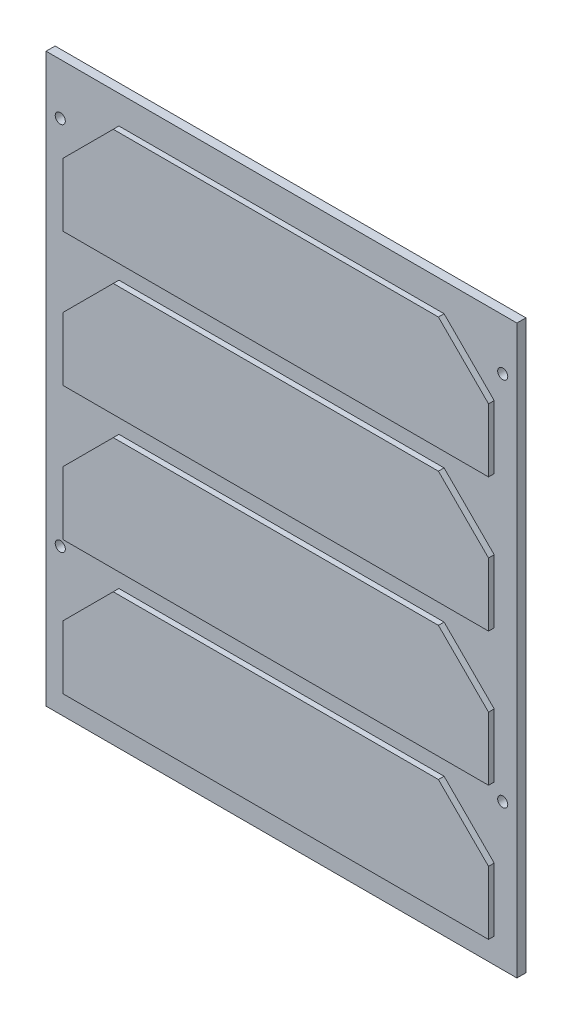
from build123d import *

# Parameters (mm, degrees)
SKETCH1_W                 = 83
SKETCH1_H                 = 100
BOSS_EXTRUDE1_DEPTH       = 1.5875
BOSS_EXTRUDE2_DEPTH       = 1
F_0_CLEARANCE_HOLE1_D     = 1.778
F_0_CLEARANCE_HOLE1_DEPTH = 3.175
F_0_CLEARANCE_HOLE1_TIP   = 0.53416509


with BuildPart() as part:
    # Sketch1 → Boss-Extrude1 (new body)
    with BuildSketch(Plane.XY):
        Rectangle(SKETCH1_W, SKETCH1_H)
    extrude(amount=BOSS_EXTRUDE1_DEPTH)

    # Sketch2 → Boss-Extrude2 (add)
    with BuildSketch(Plane.XY.offset(1.5875)):
        Polygon((-28.661165235, 45), (28.661165235, 45), (37.5, 36.161165235), (37.5, 25), (-37.5, 25), (-37.5, 36.161165235), align=None)
        Polygon((-28.661165235, 21.462440474), (28.661165235, 21.462440474), (37.5, 12.623605709), (37.5, 1.462440474), (-37.5, 1.462440474), (-37.5, 12.623605709), align=None)
        Polygon((-28.661165235, -2.075119052), (28.661165235, -2.075119052), (37.5, -10.913953817), (37.5, -22.075119052), (-37.5, -22.075119052), (-37.5, -10.913953817), align=None)
        Polygon((-28.661165235, -25.612678578), (28.661165235, -25.612678578), (37.5, -34.451513343), (37.5, -45.612678578), (-37.5, -45.612678578), (-37.5, -34.451513343), align=None)
    extrude(amount=BOSS_EXTRUDE2_DEPTH)

    # #0 Clearance Hole1
    with Locations(Plane.XY.offset(1.5875)):
        with Locations((-39, 41), (39, 41), (39, -24.333333333), (39, -89.666666667), (39, -155), (-39, -155), (-39, -89.666666667), (-39, -24.333333333)):
            Hole(F_0_CLEARANCE_HOLE1_D / 2, depth=F_0_CLEARANCE_HOLE1_DEPTH)
            with Locations((0, 0, -(F_0_CLEARANCE_HOLE1_DEPTH + F_0_CLEARANCE_HOLE1_TIP / 2))):  # 118° drill point
                Cone(0, F_0_CLEARANCE_HOLE1_D / 2, F_0_CLEARANCE_HOLE1_TIP, mode=Mode.SUBTRACT)


solid = part.part
